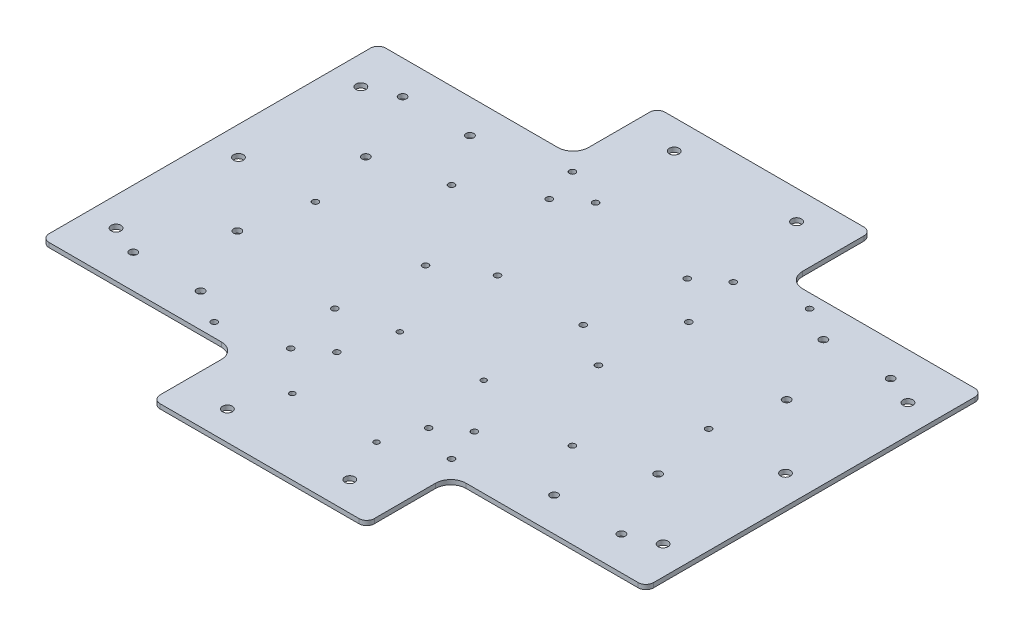
from build123d import *

# Parameters (mm, degrees)
SKETCH_1_R          = 2.5
SKETCH_1_R_2        = 3.2
EXTRUDE_1_DEPTH     = 3
SKETCH_2_R          = 2
SKETCH_2_R_2        = 1.75
CUT_EXTRUDE_1_DEPTH = 10


with BuildPart() as part:
    # Эскиз1 → Бобышка-Вытянуть1 (new body)
    with BuildSketch(Plane(origin=(0, 0, 0), x_dir=(1, 0, 0), z_dir=(0, 1, 0))):
        with BuildLine():
            ThreePointArc((-70, -160), (-68.535533906, -163.535533906), (-65, -165))
            Line((-65, -165), (65, -165))
            ThreePointArc((65, -165), (68.535533906, -163.535533906), (70, -160))
            Line((70, -160), (70, -120))
            ThreePointArc((70, -120), (72.928932188, -112.928932188), (80, -110))
            Line((80, -110), (134.901841239, -110))
            Line((134.901841239, -110), (160.901841239, -110))
            Line((160.901841239, -110), (192.5, -110))
            ThreePointArc((192.5, -110), (196.035533906, -108.535533906), (197.5, -105))
            Line((197.5, -105), (197.5, 105))
            ThreePointArc((197.5, 105), (196.035533906, 108.535533906), (192.5, 110))
            Line((192.5, 110), (160.901841239, 110))
            Line((160.901841239, 110), (134.901841239, 110))
            Line((134.901841239, 110), (80, 110))
            ThreePointArc((80, 110), (72.928932188, 112.928932188), (70, 120))
            Line((70, 120), (70, 160))
            ThreePointArc((70, 160), (68.535533906, 163.535533906), (65, 165))
            Line((65, 165), (-65, 165))
            ThreePointArc((-65, 165), (-68.535533906, 163.535533906), (-70, 160))
            Line((-70, 160), (-70, 120))
            ThreePointArc((-70, 120), (-72.928932188, 112.928932188), (-80, 110))
            Line((-80, 110), (-134.901841239, 110))
            Line((-134.901841239, 110), (-160.901841239, 110))
            Line((-160.901841239, 110), (-192.5, 110))
            ThreePointArc((-192.5, 110), (-196.035533906, 108.535533906), (-197.5, 105))
            Line((-197.5, 105), (-197.5, -105))
            ThreePointArc((-197.5, -105), (-196.035533906, -108.535533906), (-192.5, -110))
            Line((-192.5, -110), (-80, -110))
            ThreePointArc((-80, -110), (-72.928932188, -112.928932188), (-70, -120))
            Line((-70, -120), (-70, -160))
        make_face()
        with Locations((-159.5, -88)):
            Circle(SKETCH_1_R, mode=Mode.SUBTRACT)
        with Locations((-115.5, -88)):
            Circle(SKETCH_1_R, mode=Mode.SUBTRACT)
        with Locations((-40, -146)):
            Circle(SKETCH_1_R_2, mode=Mode.SUBTRACT)
        with Locations((-178.768667216, -80)):
            Circle(SKETCH_1_R_2, mode=Mode.SUBTRACT)
        with Locations((-137.5, -42)):
            Circle(SKETCH_1_R, mode=Mode.SUBTRACT)
        with Locations((40, -146)):
            Circle(SKETCH_1_R_2, mode=Mode.SUBTRACT)
        with Locations((115.5, -88)):
            Circle(SKETCH_1_R, mode=Mode.SUBTRACT)
        with Locations((159.5, -88)):
            Circle(SKETCH_1_R, mode=Mode.SUBTRACT)
        with Locations((137.5, -42)):
            Circle(SKETCH_1_R, mode=Mode.SUBTRACT)
        with Locations((178.768667216, -80)):
            Circle(SKETCH_1_R_2, mode=Mode.SUBTRACT)
        with Locations((-178.768667216, 0)):
            Circle(SKETCH_1_R_2, mode=Mode.SUBTRACT)
        with Locations((-178.768667216, 80)):
            Circle(SKETCH_1_R_2, mode=Mode.SUBTRACT)
        with Locations((-137.5, 42)):
            Circle(SKETCH_1_R, mode=Mode.SUBTRACT)
        with Locations((-159.5, 88)):
            Circle(SKETCH_1_R, mode=Mode.SUBTRACT)
        with Locations((-115.5, 88)):
            Circle(SKETCH_1_R, mode=Mode.SUBTRACT)
        with Locations((-40, 146)):
            Circle(SKETCH_1_R_2, mode=Mode.SUBTRACT)
        with Locations((178.768667216, 0)):
            Circle(SKETCH_1_R_2, mode=Mode.SUBTRACT)
        with Locations((137.5, 42)):
            Circle(SKETCH_1_R, mode=Mode.SUBTRACT)
        with Locations((178.768667216, 80)):
            Circle(SKETCH_1_R_2, mode=Mode.SUBTRACT)
        with Locations((40, 146)):
            Circle(SKETCH_1_R_2, mode=Mode.SUBTRACT)
        with Locations((115.5, 88)):
            Circle(SKETCH_1_R, mode=Mode.SUBTRACT)
        with Locations((159.5, 88)):
            Circle(SKETCH_1_R, mode=Mode.SUBTRACT)
    extrude(amount=EXTRUDE_1_DEPTH)

    # Эскиз2 → Вырез-Вытянуть1 (cut)
    with BuildSketch(Plane(origin=(0, 3, 0), x_dir=(1, 0, 0), z_dir=(0, 1, 0))):
        with Locations((128.5, 0)):
            Circle(SKETCH_2_R)
        with Locations((56.5, 0)):
            Circle(SKETCH_2_R)
        with Locations((93.5, 101)):
            Circle(SKETCH_2_R)
        with Locations((61.5, 54)):
            Circle(SKETCH_2_R)
        with Locations((53.5, 91.092247848)):
            Circle(SKETCH_2_R)
        with Locations((36.502982491, 78.046799413)):
            Circle(SKETCH_2_R)
        with Locations((28.680928288, 17.871923503)):
            Circle(SKETCH_2_R)
        with Locations((-27.319071712, 17.871923503)):
            Circle(SKETCH_2_R)
        with Locations((27.496289721, -46.022287392)):
            Circle(SKETCH_2_R_2)
        with Locations((93.5, -54.053341302)):
            Circle(SKETCH_2_R)
        with Locations((61.5, -101.042998556)):
            Circle(SKETCH_2_R)
        with Locations((53.5, -78.07249598)):
            Circle(SKETCH_2_R)
        with Locations((36.502982491, -90.999139468)):
            Circle(SKETCH_2_R)
        with Locations((27.496289721, -116.033195429)):
            Circle(SKETCH_2_R_2)
        with Locations((-27.552622159, -116.033195429)):
            Circle(SKETCH_2_R_2)
        with Locations((-27.319071712, -46)):
            Circle(SKETCH_2_R_2)
        with Locations((-53.636340651, -90.999139468)):
            Circle(SKETCH_2_R)
        with Locations((-36.401722668, -78.07249598)):
            Circle(SKETCH_2_R)
        with Locations((-93.526794479, -101.042998556)):
            Circle(SKETCH_2_R)
        with Locations((-61.727710595, -54.053341302)):
            Circle(SKETCH_2_R)
        with Locations((-36.401722668, 91.092247848)):
            Circle(SKETCH_2_R)
        with Locations((-53.636340651, 78.046799413)):
            Circle(SKETCH_2_R)
        with Locations((-61.541675198, 101)):
            Circle(SKETCH_2_R)
        with Locations((-93.526794479, 54)):
            Circle(SKETCH_2_R)
        with Locations((-128.5, 0)):
            Circle(SKETCH_2_R)
        with Locations((-56.5, 0)):
            Circle(SKETCH_2_R)
    extrude(amount=-CUT_EXTRUDE_1_DEPTH, mode=Mode.SUBTRACT)


solid = part.part
